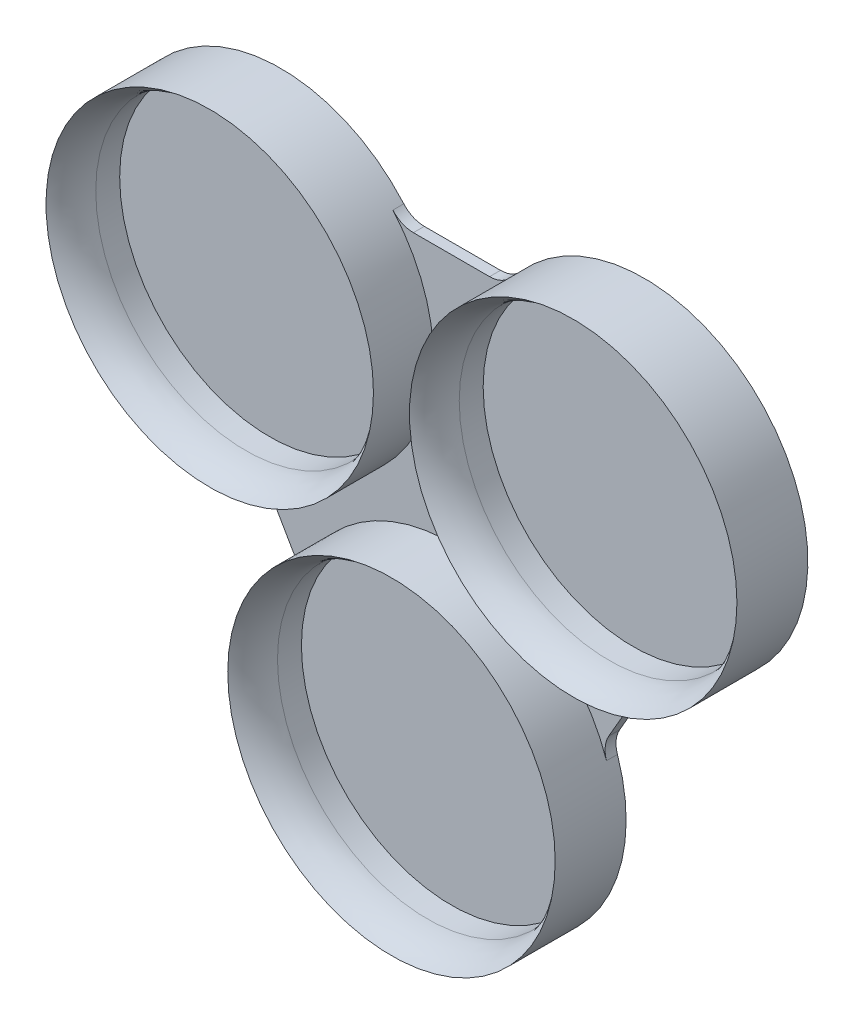
from build123d import *

# Parameters (mm, degrees)
SKETCH_1_R          = 30
SKETCH_1_R_2        = 27.5
EXTRUDE_1_DEPTH     = 13
SKETCH_1_R_3        = 29.999999999999996
EXTRUDE_1_2_DEPTH   = 13
EXTRUDE_1_3_DEPTH   = 13
EXTRUDE_2_DEPTH     = 2
SKETCH_3_R          = 1.3999999999999955
CUT_EXTRUDE_5_DEPTH = 132.10250765535577
FILLET_1_R          = 10
SKETCH_5_R          = 12.500000000000002
SKETCH_5_R_2        = 10.5
EXTRUDE_3_DEPTH     = 7
EXTRUDE_4_DEPTH     = 2


with BuildPart() as part:
    # 草图1 → 凸台-拉伸1 (new body)
    with BuildSketch(Plane.XY):
        with Locations(Location((0, 0, 0), (0, 0, 180))):
            Circle(SKETCH_1_R)
        with Locations(Location((0, 0, 0), (0, 0, 180))):
            Circle(SKETCH_1_R_2, mode=Mode.SUBTRACT)
    extrude(amount=EXTRUDE_1_DEPTH)



with BuildPart() as body_2:
    # 草图1 → Extrude 1 2 (new body)
    with BuildSketch(Plane.XY):
        with Locations(Location((66.6, 0, 0), (0, 0, 180))):
            Circle(SKETCH_1_R_3)
        with Locations(Location((66.6, 0, 0), (0, 0, 180))):
            Circle(SKETCH_1_R_2, mode=Mode.SUBTRACT)
    extrude(amount=EXTRUDE_1_2_DEPTH)


with BuildPart() as body_3:
    # 草图1 → Extrude 1 3 (new body)
    with BuildSketch(Plane.XY):
        with Locations(Location((33.30000000000001, -57.6772918920436, 0), (0, 0, 180))):
            Circle(SKETCH_1_R_3)
        with Locations(Location((33.30000000000001, -57.6772918920436, 0), (0, 0, 180))):
            Circle(SKETCH_1_R_2, mode=Mode.SUBTRACT)
    extrude(amount=EXTRUDE_1_3_DEPTH)


with BuildPart() as part_1:
    add(part.part)

    add(body_2.part)  # 凸台-拉伸2 merges body 2

    add(body_3.part)  # 凸台-拉伸2 merges body 3
    # 草图2 → 凸台-拉伸2 (add)
    with BuildSketch(Plane.XY):
        with BuildLine():
            Line((26.3198925252566, 18.070831312697457), (40.280107474743396, 18.070831312697457))
            ThreePointArc((40.280107474743396, 18.070831312697457), (42.3441853289733, 18.516758123597654), (44.04009212120862, 19.77499826802639))
            ThreePointArc((44.04009212120862, 19.77499826802639), (92.58076211353317, 15), (72.44569692050842, -29.424952464083248))
            ThreePointArc((72.44569692050842, -29.424952464083248), (70.50807559525407, -30.264530756395246), (69.08985272167097, -31.829111208097117))
            Line((69.08985272167097, -31.829111208097117), (62.10974524692759, -43.91901199664395))
            ThreePointArc((62.10974524692759, -43.91901199664395), (61.46389026628078, -45.92951925924603), (61.70560479929982, -48.027337695986766))
            ThreePointArc((61.70560479929982, -48.027337695986766), (33.300000000000004, -87.6772918920436), (4.894395200700185, -48.02733769598677))
            ThreePointArc((4.894395200700185, -48.02733769598677), (5.13610973371921, -45.92951925924604), (4.4902547530724135, -43.91901199664397))
            Line((4.4902547530724135, -43.91901199664397), (-2.489852721670984, -31.829111208097103))
            ThreePointArc((-2.489852721670984, -31.829111208097103), (-3.9080755952540875, -30.264530756395228), (-5.845696920508439, -29.42495246408323))
            ThreePointArc((-5.845696920508439, -29.42495246408323), (-25.980762113533153, 15.000000000000009), (22.55990787879137, 19.77499826802639))
            ThreePointArc((22.55990787879137, 19.77499826802639), (24.25581467102669, 18.516758123597654), (26.3198925252566, 18.070831312697457))
        make_face()
    extrude(amount=EXTRUDE_2_DEPTH)

    # 草图3 → 切除-拉伸5 (cut, through all)
    with BuildSketch(Plane.XY):
        with Locations(Location((33.3, -19.225763964014533, 0), (0, 0, 180))):
            Circle(SKETCH_3_R)
    extrude(amount=CUT_EXTRUDE_5_DEPTH, mode=Mode.SUBTRACT)

    # 圆角1
    # the kernel refuses this fillet: 10 mm, written as the material it takes off along each edge
    with BuildSketch(Plane(origin=(0, 0, 13), x_dir=(-1, 1.2e-16, 0), z_dir=(1.2e-16, 1, 0))) as fillet_1_piece_1:
        with BuildLine():
            CenterArc((37.5, -6.614378277661482), FILLET_1_R, 138.59037789072914, 41.409622109270856)
            Line((27.5, -6.614378277661482), (27.3, -6.614378277661482))
            Line((27.3, -6.614378277661482), (27.3, 0))
            Line((27.3, 0), (27.5, 0.1999999999999993))
            ThreePointArc((27.5, 0.1999999999999993), (28.75, 0.1999999999999993), (29.85, 0.1322875655532254))
            Line((29.85, 0.1322875655532254), (30, -3.55e-15))
        make_face()
    revolve(axis=Axis((0, 0, 13), (0, 0, 1)), mode=Mode.SUBTRACT)
    with BuildSketch(Plane(origin=(66.6, 0, 13), x_dir=(-1, 1.2e-16, 0), z_dir=(1.2e-16, 1, 0))) as fillet_1_piece_2:
        with BuildLine():
            CenterArc((37.5, -6.614378277661482), FILLET_1_R, 138.59037789072914, 41.409622109270856)
            Line((27.5, -6.614378277661482), (27.299999999999997, -6.614378277661482))
            Line((27.299999999999997, -6.614378277661482), (27.299999999999997, 0))
            Line((27.299999999999997, 0), (27.5, 0.1999999999999993))
            ThreePointArc((27.5, 0.1999999999999993), (28.75, 0.1999999999999993), (29.85, 0.1322875655532254))
            Line((29.85, 0.1322875655532254), (30, -3.55e-15))
        make_face()
    revolve(axis=Axis((66.6, 0, 13), (0, 0, 1)), mode=Mode.SUBTRACT)
    with BuildSketch(Plane(origin=(33.30000000000001, -57.6772918920436, 13), x_dir=(-1, 0, 0), z_dir=(0, 1, 0))) as fillet_1_piece_3:
        with BuildLine():
            CenterArc((37.5, -6.614378277661478), FILLET_1_R, 138.59037789072914, 41.409622109270856)
            Line((27.5, -6.614378277661478), (27.3, -6.614378277661478))
            Line((27.3, -6.614378277661478), (27.3, 0))
            Line((27.3, 0), (27.5, 0.1999999999999993))
            ThreePointArc((27.5, 0.1999999999999993), (28.75, 0.1999999999999993), (29.849999999999998, 0.1322875655532254))
            Line((29.849999999999998, 0.1322875655532254), (30, -3.55e-15))
        make_face()
    revolve(axis=Axis((33.30000000000001, -57.6772918920436, 13), (0, 0, 1)), mode=Mode.SUBTRACT)

    # 草图5 → 凸台-拉伸3 (add)
    with BuildSketch(Plane(origin=(0, 0, 0), x_dir=(-1, 0, 0), z_dir=(0, 0, -1))):
        with Locations(Location((-33.3, -19.225763964014533, 0), (0, 0, 180))):
            Circle(SKETCH_5_R)
        with Locations((-33.3, -19.225763964014533)):
            Circle(SKETCH_5_R_2, mode=Mode.SUBTRACT)
    extrude(amount=EXTRUDE_3_DEPTH)

    # 草图6 → 凸台-拉伸4 (add)
    with BuildSketch(Plane(origin=(0, 0, 0), x_dir=(-1, 0, 0), z_dir=(0, 0, -1))):
        with BuildLine():
            Line((-34.90331925395002, -16.05845163809636), (-43.51884380379272, -16.812212366536837))
            ThreePointArc((-43.51884380379272, -16.812212366536837), (-33.3, -8.725763964014526), (-23.08115619620727, -16.812212366536837))
            Line((-23.08115619620727, -16.812212366536837), (-31.69668074604997, -16.05845163809636))
            ThreePointArc((-31.69668074604997, -16.05845163809636), (-33.3, -15.675763964014527), (-34.90331925395002, -16.05845163809636))
        make_face()
        with BuildLine():
            Line((-34.90331925395002, -22.3930762899327), (-43.51884380379272, -21.63931556149223))
            ThreePointArc((-43.51884380379272, -21.63931556149223), (-33.3, -29.725763964014536), (-23.08115619620727, -21.63931556149223))
            Line((-23.08115619620727, -21.63931556149223), (-31.69668074604997, -22.3930762899327))
            ThreePointArc((-31.69668074604997, -22.3930762899327), (-33.3, -22.775763964014537), (-34.90331925395002, -22.3930762899327))
        make_face()
    extrude(amount=EXTRUDE_4_DEPTH)


solid = part_1.part
